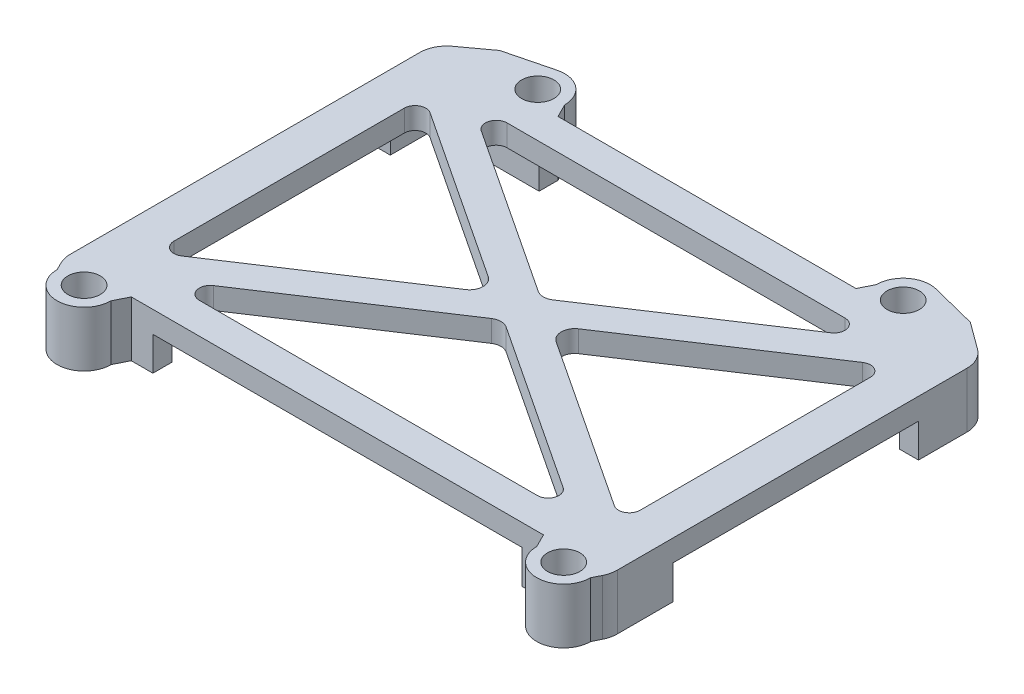
from build123d import *
from build123d.topology import SkipClean

# Parameters (mm, degrees)
SKETCH1_R                = 1.38
SKETCH1_R_2              = 1
SKETCH1_W                = 37.356294072
SKETCH1_H                = 24.2
BOSS_EXTRUDE2_DEPTH      = 1.6
BOSS_EXTRUDE3_START      = 2.5
SKETCH3_R                = 1
BOSS_EXTRUDE3_DEPTH      = 2.5
SKETCH3_5_R              = 1.38
CUT_EXTRUDE1_DEPTH       = 3
MOVE_START               = -2.5
MOVE_FACE2_OUTLINE_R     = 1.2
MOVE_FACE2_OUTLINE_R_2   = 1
MOVE_FACE2_DEPTH         = 2.5
MOVE_FACE2_2_OUTLINE_R   = 1.2
MOVE_FACE2_2_OUTLINE_R_2 = 1
MOVE_FACE2_2_DEPTH       = 1.6
FILLET4_R                = 2
CUT_EXTRUDE2_DEPTH       = 10
FILLET6_R                = 1
FILLET7_R                = 0.8


# Read off the part's stored shape, not the designer's step: Move Face2
with BuildPart() as part:
    # Sketch1 → Boss-Extrude2 (new body)
    # profile 1 of 2: a face of its own
    with BuildSketch(Plane(origin=(0, 0, 0), x_dir=(1, 0, 0), z_dir=(0, 1, 0))):
        with BuildLine():
            ThreePointArc((29.583728431, -29.708730606), (27.583728431, -31.708730606), (25.583728431, -29.708730606))
            Line((25.583728431, -29.708730606), (25.083728431, -28.708730606))
            Line((25.083728431, -28.708730606), (9.805581395, -28.708730606))
            Line((9.805581395, -28.708730606), (-5.472565641, -28.708730606))
            Line((-5.472565641, -28.708730606), (-5.972565641, -29.708730606))
            ThreePointArc((-5.972565641, -29.708730606), (-7.972565641, -31.708730606), (-9.972565641, -29.708730606))
            Line((-9.972565641, -29.708730606), (-10.472565641, -28.708730606))
            Line((-10.472565641, -28.708730606), (-10.472565641, -6.308730606))
            Line((-10.472565641, -6.308730606), (-14.622565641, 1.591269394))
            ThreePointArc((-14.622565641, 1.591269394), (-16.743885984, 6.712589737), (-11.622565641, 4.591269394))
            Line((-11.622565641, 4.591269394), (-7.637430915, 0.768132014))
            Line((-7.637430915, 0.768132014), (-4.231183814, 1.630146375))
            ThreePointArc((-4.231183814, 1.630146375), (-2.511966494, 1.269454739), (-1.740514831, -0.308730606))
            Line((-1.740514831, -0.308730606), (-1.240514831, -1.308730606))
            Line((-1.240514831, -1.308730606), (20.851677621, -1.308730606))
            Line((20.851677621, -1.308730606), (21.351677621, -0.308730606))
            ThreePointArc((21.351677621, -0.308730606), (22.123129284, 1.269454739), (23.842346605, 1.630146375))
            Line((23.842346605, 1.630146375), (27.248593706, 0.768132014))
            Line((27.248593706, 0.768132014), (31.233728431, 4.591269394))
            ThreePointArc((31.233728431, 4.591269394), (36.355048775, 6.712589737), (34.233728431, 1.591269394))
            Line((34.233728431, 1.591269394), (30.083728431, -6.308730606))
            Line((30.083728431, -6.308730606), (30.083728431, -28.708730606))
            Line((30.083728431, -28.708730606), (29.583728431, -29.708730606))
        make_face()
        with Locations(Location((34.233728431, 4.591269394, 0), (0, 0, 270))):
            Circle(SKETCH1_R, mode=Mode.SUBTRACT)
        with Locations(Location((23.351677621, -0.308730606, 0), (0, 0, 270))):
            Circle(SKETCH1_R_2, mode=Mode.SUBTRACT)
        with Locations(Location((-3.740514831, -0.308730606, 0), (0, 0, 270))):
            Circle(SKETCH1_R_2, mode=Mode.SUBTRACT)
        with Locations(Location((-7.972565641, -29.708730606, 0), (0, 0, 270))):
            Circle(SKETCH1_R_2, mode=Mode.SUBTRACT)
        with Locations(Location((-14.622565641, 4.591269394, 0), (0, 0, 270))):
            Circle(SKETCH1_R, mode=Mode.SUBTRACT)
        with Locations(Location((27.583728431, -29.708730606, 0), (0, 0, 270))):
            Circle(SKETCH1_R_2, mode=Mode.SUBTRACT)
        with Locations((9.805581395, -15.008730606)):
            Rectangle(SKETCH1_W, SKETCH1_H, mode=Mode.SUBTRACT)
    # profile 2 of 2: a face of its own
    with BuildSketch(Plane(origin=(0, 0, 0), x_dir=(1, 0, 0), z_dir=(0, 1, 0))):
        with Locations((9.805581395, -15.008730606)):
            Rectangle(SKETCH1_W, SKETCH1_H)
    extrude(amount=BOSS_EXTRUDE2_DEPTH)

    # Sketch3 → Boss-Extrude3 (add)
    # profile 1 of 4: a face of its own
    with SkipClean():  # the faces are left unmerged after this step: merging them gives an invalid solid
        with BuildSketch(Plane.XZ.offset(BOSS_EXTRUDE3_START)):
            with BuildLine():
                Line((23.483728431, 27.108730606), (28.483728431, 27.108730606))
                Line((28.483728431, 27.108730606), (28.483728431, 24.108730606))
                Line((28.483728431, 24.108730606), (30.083728431, 24.108730606))
                Line((30.083728431, 24.108730606), (30.083728431, 28.708730606))
                Line((30.083728431, 28.708730606), (29.583728431, 29.708730606))
                ThreePointArc((29.583728431, 29.708730606), (27.583728431, 31.708730606), (25.583728431, 29.708730606))
                Line((25.583728431, 29.708730606), (25.083728431, 28.708730606))
                Line((25.083728431, 28.708730606), (23.483728431, 28.708730606))
                Line((23.483728431, 28.708730606), (23.483728431, 27.108730606))
            make_face()
            with Locations(Location((27.583728431, 29.708730606, 0), (0, 0, 270))):
                Circle(SKETCH3_R, mode=Mode.SUBTRACT)
        # profile 2 of 4: a face of its own
        with BuildSketch(Plane.XZ.offset(BOSS_EXTRUDE3_START)):
            with BuildLine():
                Line((-8.872565641, 27.108730606), (-3.872565641, 27.108730606))
                Line((-3.872565641, 27.108730606), (-3.872565641, 28.708730606))
                Line((-3.872565641, 28.708730606), (-5.472565641, 28.708730606))
                Line((-5.472565641, 28.708730606), (-5.972565641, 29.708730606))
                ThreePointArc((-5.972565641, 29.708730606), (-7.972565641, 31.708730606), (-9.972565641, 29.708730606))
                Line((-9.972565641, 29.708730606), (-10.472565641, 28.708730606))
                Line((-10.472565641, 28.708730606), (-10.472565641, 24.108730606))
                Line((-10.472565641, 24.108730606), (-8.872565641, 24.108730606))
                Line((-8.872565641, 24.108730606), (-8.872565641, 27.108730606))
            make_face()
            with Locations(Location((-7.972565641, 29.708730606, 0), (0, 0, 270))):
                Circle(SKETCH3_R, mode=Mode.SUBTRACT)
        # profile 3 of 4: a face of its own
        with BuildSketch(Plane.XZ.offset(BOSS_EXTRUDE3_START)):
            with BuildLine():
                Line((30.083728431, 5.908730606), (28.483728431, 5.908730606))
                Line((28.483728431, 5.908730606), (28.483728431, 2.908730606))
                Line((28.483728431, 2.908730606), (20.851677621, 2.908730606))
                Line((20.851677621, 2.908730606), (20.851677621, 1.308730606))
                Line((20.851677621, 1.308730606), (21.351677621, 0.308730606))
                ThreePointArc((21.351677621, 0.308730606), (22.123129284, -1.269454739), (23.842346605, -1.630146375))
                Line((23.842346605, -1.630146375), (27.248593706, -0.768132014))
                Line((27.248593706, -0.768132014), (30.083728431, 1.308730606))
                Line((30.083728431, 1.308730606), (30.083728431, 5.908730606))
            make_face()
            with Locations(Location((23.351677621, 0.308730606, 0), (0, 0, 270))):
                Circle(SKETCH3_R, mode=Mode.SUBTRACT)
        # profile 4 of 4: a face of its own
        with BuildSketch(Plane.XZ.offset(BOSS_EXTRUDE3_START)):
            with BuildLine():
                Line((-8.872565641, 2.908730606), (-8.872565641, 5.908730606))
                Line((-8.872565641, 5.908730606), (-10.472565641, 5.908730606))
                Line((-10.472565641, 5.908730606), (-10.472565641, 1.308730606))
                Line((-10.472565641, 1.308730606), (-7.637430915, -0.768132014))
                Line((-7.637430915, -0.768132014), (-4.231183814, -1.630146375))
                ThreePointArc((-4.231183814, -1.630146375), (-2.511966494, -1.269454739), (-1.740514831, 0.308730606))
                Line((-1.740514831, 0.308730606), (-1.240514831, 1.308730606))
                Line((-1.240514831, 1.308730606), (-1.240514831, 2.908730606))
                Line((-1.240514831, 2.908730606), (-8.872565641, 2.908730606))
            make_face()
            with Locations(Location((-3.740514831, 0.308730606, 0), (0, 0, 270))):
                Circle(SKETCH3_R, mode=Mode.SUBTRACT)
        extrude(amount=-BOSS_EXTRUDE3_DEPTH)

    # Sketch3<5> → Cut-Extrude1 (cut)
    # profile 1 of 2: a face of its own
    with SkipClean():  # the faces are left unmerged after this step: merging them gives an invalid solid
        with BuildSketch(Plane.XZ):
            with BuildLine():
                Line((27.248593706, -0.768132014), (30.083728431, 1.308730606))
                Line((30.083728431, 1.308730606), (30.083728431, 6.308730606))
                Line((30.083728431, 6.308730606), (34.233728431, -1.591269394))
                ThreePointArc((34.233728431, -1.591269394), (36.355048775, -6.712589737), (31.233728431, -4.591269394))
                Line((31.233728431, -4.591269394), (27.248593706, -0.768132014))
            make_face()
            with Locations((34.233728431, -4.591269394)):
                Circle(SKETCH3_5_R, mode=Mode.SUBTRACT)
        # profile 2 of 2: a face of its own
        with BuildSketch(Plane.XZ):
            with BuildLine():
                Line((-10.472565641, 1.308730606), (-7.637430915, -0.768132014))
                Line((-7.637430915, -0.768132014), (-11.622565641, -4.591269394))
                ThreePointArc((-11.622565641, -4.591269394), (-16.743885984, -6.712589737), (-14.622565641, -1.591269394))
                Line((-14.622565641, -1.591269394), (-10.472565641, 6.308730606))
                Line((-10.472565641, 6.308730606), (-10.472565641, 1.308730606))
            make_face()
            with Locations((-14.622565641, -4.591269394)):
                Circle(SKETCH3_5_R, mode=Mode.SUBTRACT)
        extrude(amount=-CUT_EXTRUDE1_DEPTH, mode=Mode.SUBTRACT)

    # Move Face2 outline → Move Face2 (cut)
    # profile 1 of 8: a face of its own
    with BuildSketch(Plane(origin=(0, 0, 0), x_dir=(1, 0, 0), z_dir=(0, 1, 0)).offset(MOVE_START)):
        with Locations((-7.972565641, -29.708730606)):
            Circle(MOVE_FACE2_OUTLINE_R)
        with Locations((-7.972565641, -29.708730606)):
            Circle(MOVE_FACE2_OUTLINE_R_2, mode=Mode.SUBTRACT)
    # profile 2 of 8: a face of its own
    with BuildSketch(Plane(origin=(0, 0, 0), x_dir=(1, 0, 0), z_dir=(0, 1, 0)).offset(MOVE_START)):
        with Locations((-3.740514831, -0.308730606)):
            Circle(MOVE_FACE2_OUTLINE_R)
        with Locations((-3.740514831, -0.308730606)):
            Circle(MOVE_FACE2_OUTLINE_R_2, mode=Mode.SUBTRACT)
    # profile 3 of 8: a face of its own
    with BuildSketch(Plane(origin=(0, 0, 0), x_dir=(1, 0, 0), z_dir=(0, 1, 0)).offset(MOVE_START)):
        with Locations((23.351677621, -0.308730606)):
            Circle(MOVE_FACE2_OUTLINE_R)
        with Locations((23.351677621, -0.308730606)):
            Circle(MOVE_FACE2_OUTLINE_R_2, mode=Mode.SUBTRACT)
    # profile 4 of 8: a face of its own
    with BuildSketch(Plane(origin=(0, 0, 0), x_dir=(1, 0, 0), z_dir=(0, 1, 0)).offset(MOVE_START)):
        with Locations((27.583728431, -29.708730606)):
            Circle(MOVE_FACE2_OUTLINE_R)
        with Locations((27.583728431, -29.708730606)):
            Circle(MOVE_FACE2_OUTLINE_R_2, mode=Mode.SUBTRACT)
    # profile 5 of 8: a face of its own
    with BuildSketch(Plane(origin=(0, 0, 0), x_dir=(1, 0, 0), z_dir=(0, 1, 0)).offset(MOVE_START)):
        Polygon((23.483728431, -27.308730606), (28.683728431, -27.308730606), (28.683728431, -24.108730606), (28.483728431, -24.108730606), (28.483728431, -27.108730606), (23.483728431, -27.108730606), align=None)
    # profile 6 of 8: a face of its own
    with BuildSketch(Plane(origin=(0, 0, 0), x_dir=(1, 0, 0), z_dir=(0, 1, 0)).offset(MOVE_START)):
        Polygon((-9.072565641, -27.308730606), (-3.872565641, -27.308730606), (-3.872565641, -27.108730606), (-8.872565641, -27.108730606), (-8.872565641, -24.108730606), (-9.072565641, -24.108730606), align=None)
    # profile 7 of 8: a face of its own
    with BuildSketch(Plane(origin=(0, 0, 0), x_dir=(1, 0, 0), z_dir=(0, 1, 0)).offset(MOVE_START)):
        Polygon((28.683728431, -5.908730606), (28.683728431, -2.708730606), (20.851677621, -2.708730606), (20.851677621, -2.908730606), (28.483728431, -2.908730606), (28.483728431, -5.908730606), align=None)
    # profile 8 of 8: a face of its own
    with BuildSketch(Plane(origin=(0, 0, 0), x_dir=(1, 0, 0), z_dir=(0, 1, 0)).offset(MOVE_START)):
        Polygon((-9.072565641, -2.708730606), (-9.072565641, -5.908730606), (-8.872565641, -5.908730606), (-8.872565641, -2.908730606), (-1.240514831, -2.908730606), (-1.240514831, -2.708730606), align=None)
    extrude(amount=MOVE_FACE2_DEPTH, mode=Mode.SUBTRACT)

    # Move Face2 2 outline → Move Face2 2 (cut)
    # profile 1 of 4: a face of its own
    with BuildSketch(Plane(origin=(0, 0, 0), x_dir=(1, 0, 0), z_dir=(0, 1, 0))):
        with Locations((-7.972565641, -29.708730606)):
            Circle(MOVE_FACE2_2_OUTLINE_R)
        with Locations((-7.972565641, -29.708730606)):
            Circle(MOVE_FACE2_2_OUTLINE_R_2, mode=Mode.SUBTRACT)
    # profile 2 of 4: a face of its own
    with BuildSketch(Plane(origin=(0, 0, 0), x_dir=(1, 0, 0), z_dir=(0, 1, 0))):
        with Locations((-3.740514831, -0.308730606)):
            Circle(MOVE_FACE2_2_OUTLINE_R)
        with Locations((-3.740514831, -0.308730606)):
            Circle(MOVE_FACE2_2_OUTLINE_R_2, mode=Mode.SUBTRACT)
    # profile 3 of 4: a face of its own
    with BuildSketch(Plane(origin=(0, 0, 0), x_dir=(1, 0, 0), z_dir=(0, 1, 0))):
        with Locations((23.351677621, -0.308730606)):
            Circle(MOVE_FACE2_2_OUTLINE_R)
        with Locations((23.351677621, -0.308730606)):
            Circle(MOVE_FACE2_2_OUTLINE_R_2, mode=Mode.SUBTRACT)
    # profile 4 of 4: a face of its own
    with BuildSketch(Plane(origin=(0, 0, 0), x_dir=(1, 0, 0), z_dir=(0, 1, 0))):
        with Locations((27.583728431, -29.708730606)):
            Circle(MOVE_FACE2_2_OUTLINE_R)
        with Locations((27.583728431, -29.708730606)):
            Circle(MOVE_FACE2_2_OUTLINE_R_2, mode=Mode.SUBTRACT)
    extrude(amount=MOVE_FACE2_2_DEPTH, mode=Mode.SUBTRACT)

    # Fillet4
    fillet4_edges = [part.edges().sort_by_distance(p)[0] for p in [
        (-10.472565641, -0.45, 1.308730606),
        (30.083728431, -0.45, 1.308730606),
        (-10.472565641, -0.45, 28.708730606),
        (30.083728431, -0.45, 28.708730606),
    ]]
    fillet(fillet4_edges, radius=FILLET4_R)

    # Sketch6 → Cut-Extrude2 (cut)
    with BuildSketch(Plane.XZ):
        Polygon((-7.472565641, 25.030971684), (-7.472565641, 4.986489529), (7.717412865, 15.008730606), align=None)
        Polygon((9.805581395, 16.386489529), (24.995559901, 26.408730606), (-5.38439711, 26.408730606), align=None)
        Polygon((11.893749926, 15.008730606), (27.083728431, 4.986489529), (27.083728431, 25.030971684), align=None)
        Polygon((-5.38439711, 3.608730606), (24.995559901, 3.608730606), (9.805581395, 13.630971684), align=None)
    extrude(amount=-CUT_EXTRUDE2_DEPTH, mode=Mode.SUBTRACT)

    # Fillet6
    fillet6_edges = [part.edges().sort_by_distance(p)[0] for p in [
        (11.893749926, 0.8, 15.008730606),
        (9.805581395, 0.8, 16.386489529),
        (9.805581395, 0.8, 13.630971684),
        (7.717412865, 0.8, 15.008730606),
    ]]
    fillet(fillet6_edges, radius=FILLET6_R)

    # Fillet7
    fillet7_edges = [part.edges().sort_by_distance(p)[0] for p in [
        (27.083728431, 0.8, 4.986489529),
        (27.083728431, 0.8, 25.030971684),
        (-5.38439711, 0.8, 26.408730606),
        (24.995559901, 0.8, 26.408730606),
        (24.995559901, 0.8, 3.608730606),
        (-5.38439711, 0.8, 3.608730606),
        (-7.472565641, 0.8, 4.986489529),
        (-7.472565641, 0.8, 25.030971684),
    ]]
    fillet(fillet7_edges, radius=FILLET7_R)


solid = part.part
